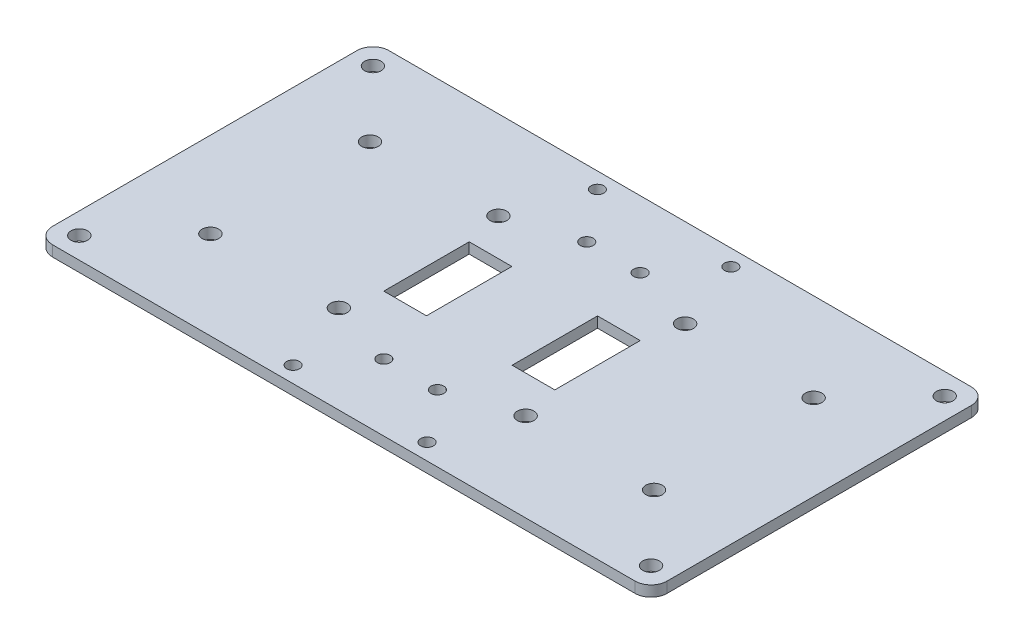
from build123d import *

# Parameters (mm, degrees)
ESBO_O1_W                = 115.09677689
ESBO_O1_H                = 63
RESSALTO_EXTRUS_O1_DEPTH = 2
ESBO_O2_R                = 1.55
CORTE_EXTRUS_O1_DEPTH    = 66.635866816
ESBO_O5_R                = 1.55
CORTE_EXTRUS_O3_DEPTH    = 66.635866816
FILETE1_R                = 3
ESBO_O8_R                = 1.2
CORTE_EXTRUS_O4_DEPTH    = 66.635866816
ESBO_O9_W                = 8
ESBO_O9_H                = 16
CORTE_EXTRUS_O5_DEPTH    = 66.635866816


with BuildPart() as part:
    # Esboço1 → Ressalto-extrusão1 (new body)
    with BuildSketch(Plane(origin=(0, 0, 0), x_dir=(1, 0, 0), z_dir=(0, 1, 0))):
        Rectangle(ESBO_O1_W, ESBO_O1_H)
    extrude(amount=RESSALTO_EXTRUS_O1_DEPTH)

    # Esboço2 → Corte-extrusão1 (cut, through all)
    with BuildSketch(Plane(origin=(0, 2, 0), x_dir=(1, 0, 0), z_dir=(0, 1, 0))):
        with Locations((-41.548388445, -14.945)):
            Circle(ESBO_O2_R)
        with Locations((-17.488388445, -14.94)):
            Circle(ESBO_O2_R)
        with Locations((17.488388445, -14.94)):
            Circle(ESBO_O2_R)
        with Locations((41.548388445, -14.945)):
            Circle(ESBO_O2_R)
        with Locations((41.548388445, 14.945)):
            Circle(ESBO_O2_R)
        with Locations((17.488388445, 14.94)):
            Circle(ESBO_O2_R)
        with Locations((-17.488388445, 14.94)):
            Circle(ESBO_O2_R)
        with Locations((-41.548388445, 14.945)):
            Circle(ESBO_O2_R)
    extrude(amount=-CORTE_EXTRUS_O1_DEPTH, mode=Mode.SUBTRACT)

    # Esboço5 → Corte-extrusão3 (cut, through all)
    with BuildSketch(Plane(origin=(0, 2, 0), x_dir=(1, 0, 0), z_dir=(0, 1, 0))):
        with Locations((53.548388445, 27.5)):
            Circle(ESBO_O5_R)
        with Locations((53.548388445, -27.5)):
            Circle(ESBO_O5_R)
        with Locations((-53.548388445, -27.5)):
            Circle(ESBO_O5_R)
        with Locations((-53.548388445, 27.5)):
            Circle(ESBO_O5_R)
    extrude(amount=-CORTE_EXTRUS_O3_DEPTH, mode=Mode.SUBTRACT)

    # Filete1
    filete1_edges = [part.edges().sort_by_distance(p)[0] for p in [
        (57.548388445, 1, -31.5),
        (57.548388445, 1, 31.5),
        (-57.548388445, 1, 31.5),
        (-57.548388445, 1, -31.5),
    ]]
    fillet(filete1_edges, radius=FILETE1_R)

    # Esboço8 → Corte-extrusão4 (cut, through all)
    with BuildSketch(Plane(origin=(0, 2, 0), x_dir=(1, 0, 0), z_dir=(0, 1, 0))):
        with Locations((-12.5, -28.5)):
            Circle(ESBO_O8_R)
        with Locations((-5, -19)):
            Circle(ESBO_O8_R)
        with Locations((5.009385606, -18.98114003)):
            Circle(ESBO_O8_R)
        with Locations((12.545132566, -28.452809247)):
            Circle(ESBO_O8_R)
        with Locations((12.545132566, 28.452809247)):
            Circle(ESBO_O8_R)
        with Locations((5.009385606, 18.98114003)):
            Circle(ESBO_O8_R)
        with Locations((-5, 19)):
            Circle(ESBO_O8_R)
        with Locations((-12.5, 28.5)):
            Circle(ESBO_O8_R)
    extrude(amount=-CORTE_EXTRUS_O4_DEPTH, mode=Mode.SUBTRACT)

    # Esboço9 → Corte-extrusão5 (cut, through all)
    with BuildSketch(Plane.XZ):
        with Locations((-12.018388445, 0)):
            Rectangle(ESBO_O9_W, ESBO_O9_H)
        with Locations((12.018388445, 0)):
            Rectangle(ESBO_O9_W, ESBO_O9_H)
    extrude(amount=-CORTE_EXTRUS_O5_DEPTH, mode=Mode.SUBTRACT)


solid = part.part
